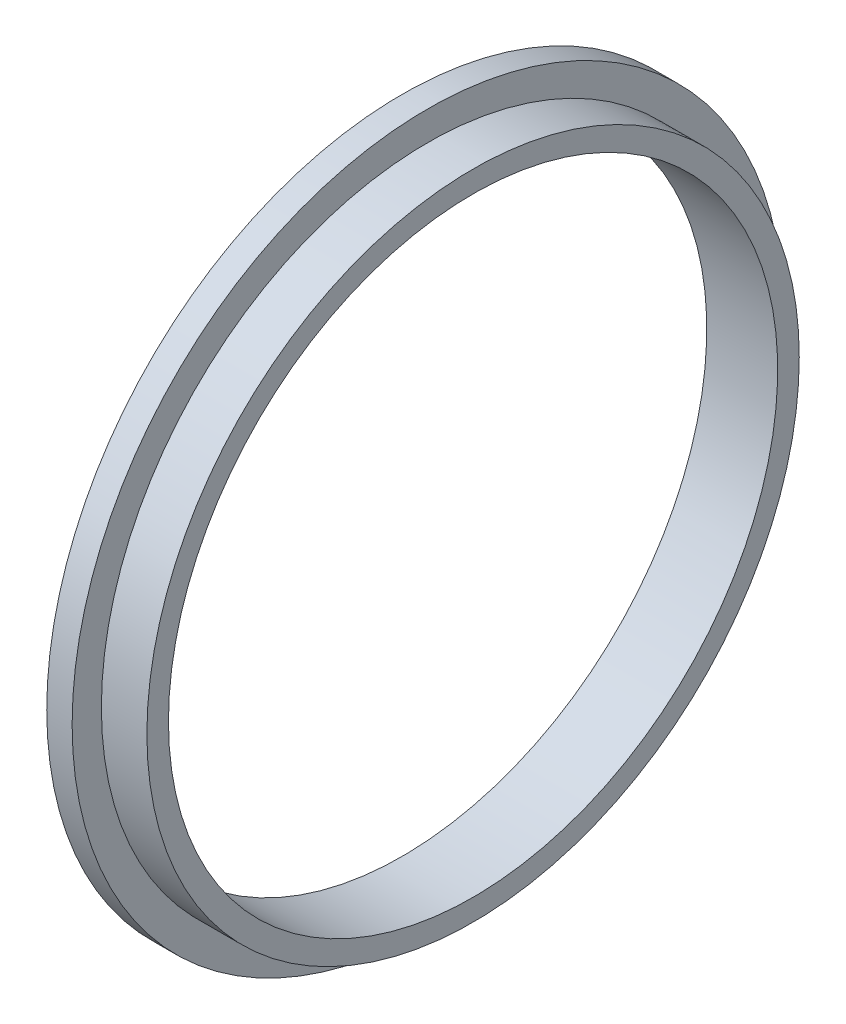
from build123d import *

# Parameters (mm, degrees)
SKETCH1_R           = 11.901099896
SKETCH1_R_2         = 10.2
BOSS_EXTRUDE1_DEPTH = 0.850000078
SKETCH2_R           = 10.922
SKETCH2_R_2         = 10.2
BOSS_EXTRUDE2_DEPTH = 1.524


with BuildPart() as part:
    # Sketch1 → Boss-Extrude1 (new body)
    with BuildSketch(Plane(origin=(0, 0, 0), x_dir=(0, 0, -1), z_dir=(1, 0, 0))):
        Circle(SKETCH1_R)
        Circle(SKETCH1_R_2, mode=Mode.SUBTRACT)
    extrude(amount=BOSS_EXTRUDE1_DEPTH)

    # Sketch2 → Boss-Extrude2 (add)
    with BuildSketch(Plane(origin=(0.850000078, 0, 0), x_dir=(0, 0, -1), z_dir=(1, 0, 0))):
        Circle(SKETCH2_R)
        Circle(SKETCH2_R_2, mode=Mode.SUBTRACT)
    extrude(amount=BOSS_EXTRUDE2_DEPTH)


solid = part.part
